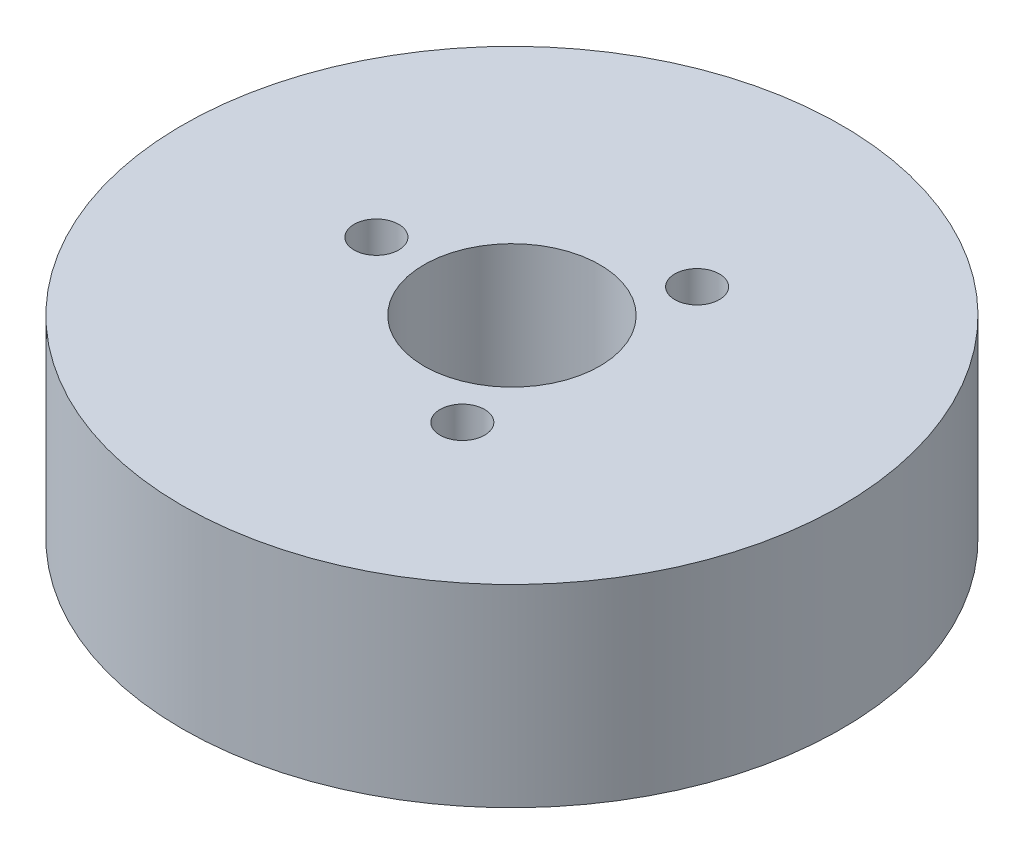
from build123d import *

# Parameters (mm, degrees)
SKETCH1_R           = 37.5
BOSS_EXTRUDE1_DEPTH = 22
SKETCH2_R           = 10
CUT_EXTRUDE1_DEPTH  = 58.415154794
SKETCH3_R           = 2.53900813
CUT_EXTRUDE2_DEPTH  = 18.97933991
CIRPATTERN1_COUNT   = 3


with BuildPart() as part:
    # Sketch1 → Boss-Extrude1 (new body)
    with BuildSketch(Plane(origin=(0, 0, 0), x_dir=(1, 0, 0), z_dir=(0, 1, 0))):
        Circle(SKETCH1_R)
    extrude(amount=BOSS_EXTRUDE1_DEPTH)

    # Sketch2 → Cut-Extrude1 (cut, through all)
    with BuildSketch(Plane(origin=(0, 0, 0), x_dir=(1, 0, 0), z_dir=(0, 1, 0))):
        Circle(SKETCH2_R)
    extrude(amount=CUT_EXTRUDE1_DEPTH, mode=Mode.SUBTRACT)

    # Sketch3 → Cut-Extrude2 (cut)
    with BuildSketch(Plane(origin=(0, 22, 0), x_dir=(1, 0, 0), z_dir=(0, 1, 0))):
        with Locations((-15.422383885, 0)):
            Circle(SKETCH3_R)
    cut_extrude2 = extrude(amount=-CUT_EXTRUDE2_DEPTH, mode=Mode.SUBTRACT)

    # CirPattern1: Cut-Extrude2 ×3 about axis
    cirpattern1_axis = Axis((0, 0, 0), (0, 1, 0))
    for i in range(1, CIRPATTERN1_COUNT):
        add(cut_extrude2.rotate(cirpattern1_axis, i * 360 / CIRPATTERN1_COUNT), mode=Mode.SUBTRACT)


solid = part.part
